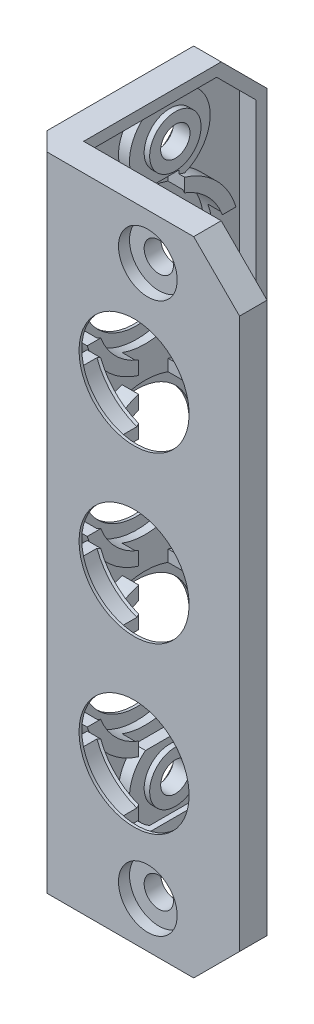
from build123d import *

# Parameters (mm, degrees)
EXTRUDE_THIN1_DEPTH     = 88.9
CHAMFER4_SIZE           = 2.54
CHAMFER1_SIZE           = 6.35
SKETCH2_R               = 9.2583
CUT_EXTRUDE1_DEPTH      = 3.429
SKETCH9_R               = 9.2583
SKETCH9_R_2             = 9.0043
EXTRUDE_THIN2_DEPTH     = 0.254
SKETCH4_R               = 7.62
CUT_EXTRUDE3_DEPTH      = 96.882897328
SKETCH3_R               = 9.2583
CUT_EXTRUDE2_DEPTH      = 3.429
SKETCH10_R              = 9.2583
SKETCH10_R_2            = 9.0043
EXTRUDE_THIN3_DEPTH     = 0.254
SKETCH5_R               = 7.62
CUT_EXTRUDE4_DEPTH      = 96.882897328
LPATTERN1_COUNT         = 3
LPATTERN1_PITCH         = 22.86
HOLE1_D                 = 4.064
HOLE1_CBORE_D           = 8.128
HOLE1_CBORE_DEPTH       = 1.524
HOLE2_D                 = 4.064
HOLE2_DEPTH             = 29.21
HOLE2_CBORE_D           = 8.128
HOLE2_CBORE_DEPTH       = 1.524
SHELL1_OUTLINE_R        = 10.7823
SHELL1_DEPTH            = 2.286
SHELL1_START            = -0.0126999
SHELL1_2_OUTLINE_R      = 3.556
SHELL1_2_DEPTH          = 0.7746999
SHELL1_START_2          = -2.286
SHELL1_3_OUTLINE_R      = 10.7823
SHELL1_3_DEPTH          = 2.286
SHELL1_START_3          = -0.762
SHELL1_4_OUTLINE_R      = 3.556
SHELL1_4_DEPTH          = 0.762
SHELL1_START_4          = 1.524
SHELL1_5_DEPTH          = 85.852
SHELL1_START_5          = 1
SHELL1_6_DEPTH          = 87
CHAMFER3_SIZE           = 0.254
CUT_EXTRUDE_THIN1_REACH = 97.883
SKETCH11_W              = 6.35
SKETCH11_H              = 67.2846
SKETCH11_W_2            = 21.5646
SKETCH11_H_2            = 6.35
CUT_EXTRUDE_THIN2_START = -2.286
SKETCH13_W              = 6.35
SKETCH13_H              = 67.2846
SKETCH13_W_2            = 21.5646
SKETCH13_H_2            = 6.35
CUT_EXTRUDE_THIN2_DEPTH = 2.286


with BuildPart() as part:
    # Sketch1 → Extrude-Thin1 (new body)
    with BuildSketch(Plane(origin=(0, 0, 0), x_dir=(1, 0, 0), z_dir=(0, 1, 0))):
        Polygon((0, 25.4), (0, 0), (25.4, 0), (25.4, -3.81), (-3.81, -3.81), (-3.81, 25.4), align=None)
    extrude(amount=EXTRUDE_THIN1_DEPTH)

    # Chamfer4
    chamfer4_edges = [part.edges().sort_by_distance(p)[0] for p in [
        (-3.81, 44.45, 3.81),
    ]]
    chamfer(chamfer4_edges, length=CHAMFER4_SIZE)

    # Chamfer1
    chamfer1_edges = [part.edges().sort_by_distance(p)[0] for p in [
        (-1.905, 88.9, -25.4),
        (-1.905, 0, -25.4),
        (25.4, 0, 1.905),
        (25.4, 88.9, 1.905),
    ]]
    chamfer(chamfer1_edges, length=CHAMFER1_SIZE)

    # Sketch2 → Cut-Extrude1 (cut)
    with BuildSketch(Plane(origin=(0, 0, 0), x_dir=(-1, 0, 0), z_dir=(0, 0, -1))):
        with Locations((-10.795, 67.31)):
            Circle(SKETCH2_R)
    cut_extrude1 = extrude(amount=-CUT_EXTRUDE1_DEPTH, mode=Mode.SUBTRACT)

    # Sketch9 → Extrude-Thin2 (add)
    with BuildSketch(Plane(origin=(0, 0, 0), x_dir=(-1, 0, 0), z_dir=(0, 0, -1))):
        with Locations((-10.795, 67.31)):
            Circle(SKETCH9_R)
        with Locations((-10.795, 67.31)):
            Circle(SKETCH9_R_2, mode=Mode.SUBTRACT)
    extrude_thin2 = extrude(amount=-EXTRUDE_THIN2_DEPTH)

    # Sketch4 → Cut-Extrude3 (cut, through all)
    with BuildSketch(Plane(origin=(0, 0, 0), x_dir=(-1, 0, 0), z_dir=(0, 0, -1))):
        with Locations((-10.795, 67.31)):
            Circle(SKETCH4_R)
    cut_extrude3 = extrude(amount=-CUT_EXTRUDE3_DEPTH, mode=Mode.SUBTRACT)

    # Sketch3 → Cut-Extrude2 (cut)
    with BuildSketch(Plane(origin=(0, 0, 0), x_dir=(0, 0, -1), z_dir=(1, 0, 0))):
        with Locations((10.795, 67.31)):
            Circle(SKETCH3_R)
    cut_extrude2 = extrude(amount=-CUT_EXTRUDE2_DEPTH, mode=Mode.SUBTRACT)

    # Sketch10 → Extrude-Thin3 (add)
    with BuildSketch(Plane(origin=(0, 0, 0), x_dir=(0, 0, -1), z_dir=(1, 0, 0))):
        with Locations((10.795, 67.31)):
            Circle(SKETCH10_R)
        with Locations((10.795, 67.31)):
            Circle(SKETCH10_R_2, mode=Mode.SUBTRACT)
    extrude_thin3 = extrude(amount=-EXTRUDE_THIN3_DEPTH)

    # Sketch5 → Cut-Extrude4 (cut, through all)
    with BuildSketch(Plane(origin=(0, 0, 0), x_dir=(0, 0, -1), z_dir=(1, 0, 0))):
        with Locations((10.795, 67.31)):
            Circle(SKETCH5_R)
    cut_extrude4 = extrude(amount=-CUT_EXTRUDE4_DEPTH, mode=Mode.SUBTRACT)

    # LPattern1: Cut-Extrude1, Extrude-Thin2, Cut-Extrude3, Cut-Extrude2, Extrude-Thin3, Cut-Extrude4 ×3
    with Locations(*[(0, -i * LPATTERN1_PITCH, 0) for i in range(1, LPATTERN1_COUNT)]):
        add(cut_extrude1, mode=Mode.SUBTRACT)
        add(extrude_thin2)
        add(cut_extrude3, mode=Mode.SUBTRACT)
        add(cut_extrude2, mode=Mode.SUBTRACT)
        add(extrude_thin3)
        add(cut_extrude4, mode=Mode.SUBTRACT)

    # Hole1 (through all)
    with Locations(Plane.XY.offset(3.81)):
        with Locations((12.7, 82.55), (12.7, 6.35)):
            CounterBoreHole(HOLE1_D / 2, HOLE1_CBORE_D / 2, HOLE1_CBORE_DEPTH)

    # Hole2
    with Locations(Plane.ZY.offset(3.81)):
        with Locations((-12.7, 82.55), (-12.7, 6.35)):
            CounterBoreHole(HOLE2_D / 2, HOLE2_CBORE_D / 2, HOLE2_CBORE_DEPTH, depth=HOLE2_DEPTH)

    # Shell1: read off the stored shape, not the designer's step
    # Shell1 outline → Shell1 (cut)
    with BuildSketch(Plane.XY):
        with BuildLine():
            ThreePointArc((15.516996273, 87.376), (18.271143767, 82.116293733), (14.736188344, 77.346185915))
            ThreePointArc((14.736188344, 77.346185915), (9.457620281, 56.61096225), (9.445524753, 78.007518864))
            ThreePointArc((9.445524753, 78.007518864), (7.11808265, 82.810658205), (9.883003727, 87.376))
            Line((9.883003727, 87.376), (0, 87.376))
            Line((0, 87.376), (0, 1.524))
            Line((0, 1.524), (9.883003727, 1.524))
            ThreePointArc((9.883003727, 1.524), (7.11808265, 6.089341795), (9.445524753, 10.892481136))
            ThreePointArc((9.445524753, 10.892481136), (9.457620281, 32.28903775), (14.736188344, 11.553814085))
            ThreePointArc((14.736188344, 11.553814085), (18.271143767, 6.783706267), (15.516996273, 1.524))
            Line((15.516996273, 1.524), (18.418738531, 1.524))
            Line((18.418738531, 1.524), (23.876, 6.981261469))
            Line((23.876, 6.981261469), (23.876, 81.918738531))
            Line((23.876, 81.918738531), (18.418738531, 87.376))
            Line((18.418738531, 87.376), (15.516996273, 87.376))
        make_face()
        with Locations((10.795, 44.45)):
            Circle(SHELL1_OUTLINE_R, mode=Mode.SUBTRACT)
    extrude(amount=SHELL1_DEPTH, mode=Mode.SUBTRACT)

    # Shell1 2 outline → Shell1 2 (cut)
    # profile 1 of 3: a face of its own
    with BuildSketch(Plane.XY.offset(SHELL1_START)):
        with BuildLine():
            ThreePointArc((9.445524753, 78.007518864), (12.132379719, 78.00903775), (14.736188344, 77.346185915))
            ThreePointArc((14.736188344, 77.346185915), (18.271143767, 82.116293733), (15.516996273, 87.376))
            Line((15.516996273, 87.376), (9.883003727, 87.376))
            ThreePointArc((9.883003727, 87.376), (7.11808265, 82.810658205), (9.445524753, 78.007518864))
        make_face()
        with Locations((12.7, 82.55)):
            Circle(SHELL1_2_OUTLINE_R, mode=Mode.SUBTRACT)
    # profile 2 of 3: a face of its own
    with BuildSketch(Plane.XY.offset(SHELL1_START)):
        Polygon((0, 1.524), (0, 87.376), (-0.762, 87.376), (-2.286, 87.376), (-2.286, 1.524), (-0.762, 1.524), align=None)
    # profile 3 of 3: a face of its own
    with BuildSketch(Plane.XY.offset(SHELL1_START)):
        with BuildLine():
            ThreePointArc((9.445524753, 10.892481136), (7.11808265, 6.089341795), (9.883003727, 1.524))
            Line((9.883003727, 1.524), (15.516996273, 1.524))
            ThreePointArc((15.516996273, 1.524), (18.271143767, 6.783706267), (14.736188344, 11.553814085))
            ThreePointArc((14.736188344, 11.553814085), (12.132379719, 10.89096225), (9.445524753, 10.892481136))
        make_face()
        with Locations((12.7, 6.35)):
            Circle(SHELL1_2_OUTLINE_R, mode=Mode.SUBTRACT)
    extrude(amount=SHELL1_2_DEPTH, mode=Mode.SUBTRACT)

    # Shell1 3 outline → Shell1 3 (cut)
    # profile 1 of 3: a face of its own
    with BuildSketch(Plane.YZ.offset(SHELL1_START_2)):
        with BuildLine():
            ThreePointArc((1.524, -9.883003727), (6.089341795, -7.11808265), (10.892481136, -9.445524753))
            ThreePointArc((10.892481136, -9.445524753), (14.458816847, -2.707712437), (21.59, -0.0127))
            Line((21.59, -0.0127), (1.524, -0.0126999))
            Line((1.524, -0.0126999), (1.524, -9.883003727))
        make_face()
    # profile 2 of 3: a face of its own
    with BuildSketch(Plane.YZ.offset(SHELL1_START_2)):
        with BuildLine():
            ThreePointArc((21.59, -0.0127), (30.499350941, -16.868010712), (11.553814085, -14.736188344))
            ThreePointArc((11.553814085, -14.736188344), (6.783706267, -18.271143767), (1.524, -15.516996273))
            Line((1.524, -15.516996273), (1.524, -18.418738531))
            Line((1.524, -18.418738531), (6.981261469, -23.876))
            Line((6.981261469, -23.876), (81.918738531, -23.876))
            Line((81.918738531, -23.876), (87.376, -18.418738531))
            Line((87.376, -18.418738531), (87.376, -15.516996273))
            ThreePointArc((87.376, -15.516996273), (82.116293733, -18.271143767), (77.346185915, -14.736188344))
            ThreePointArc((77.346185915, -14.736188344), (58.400649059, -16.868010712), (67.31, -0.0127))
            Line((67.31, -0.0127), (44.45, -0.0126999))
            Line((44.45, -0.0126999), (21.59, -0.0127))
        make_face()
        with Locations((44.45, -10.795)):
            Circle(SHELL1_3_OUTLINE_R, mode=Mode.SUBTRACT)
    # profile 3 of 3: a face of its own
    with BuildSketch(Plane.YZ.offset(SHELL1_START_2)):
        with BuildLine():
            Line((87.376, -0.0126999), (67.31, -0.0127))
            ThreePointArc((67.31, -0.0127), (74.441183153, -2.707712437), (78.007518864, -9.445524753))
            ThreePointArc((78.007518864, -9.445524753), (82.810658205, -7.11808265), (87.376, -9.883003727))
            Line((87.376, -9.883003727), (87.376, -0.0126999))
        make_face()
    extrude(amount=SHELL1_3_DEPTH, mode=Mode.SUBTRACT)

    # Shell1 4 outline → Shell1 4 (cut)
    # profile 1 of 2: a face of its own
    with BuildSketch(Plane.YZ.offset(SHELL1_START_3)):
        with BuildLine():
            ThreePointArc((11.553814085, -14.736188344), (10.89096225, -12.132379719), (10.892481136, -9.445524753))
            ThreePointArc((10.892481136, -9.445524753), (6.089341795, -7.11808265), (1.524, -9.883003727))
            Line((1.524, -9.883003727), (1.524, -15.516996273))
            ThreePointArc((1.524, -15.516996273), (6.783706267, -18.271143767), (11.553814085, -14.736188344))
        make_face()
        with Locations((6.35, -12.7)):
            Circle(SHELL1_4_OUTLINE_R, mode=Mode.SUBTRACT)
    # profile 2 of 2: a face of its own
    with BuildSketch(Plane.YZ.offset(SHELL1_START_3)):
        with BuildLine():
            ThreePointArc((87.376, -9.883003727), (82.810658205, -7.11808265), (78.007518864, -9.445524753))
            ThreePointArc((78.007518864, -9.445524753), (78.00903775, -12.132379719), (77.346185915, -14.736188344))
            ThreePointArc((77.346185915, -14.736188344), (82.116293733, -18.271143767), (87.376, -15.516996273))
            Line((87.376, -15.516996273), (87.376, -9.883003727))
        make_face()
        with Locations((82.55, -12.7)):
            Circle(SHELL1_4_OUTLINE_R, mode=Mode.SUBTRACT)
    extrude(amount=SHELL1_4_DEPTH, mode=Mode.SUBTRACT)

    # Shell1 5 outline → Shell1 5 (cut)
    with BuildSketch(Plane(origin=(0, 0, 0), x_dir=(1, 0, 0), z_dir=(0, 1, 0)).offset(SHELL1_START_4)):
        Polygon((-2.162738531, -0.762), (-0.638738531, -2.286), (0, -2.286), (0, -0.762), align=None)
    extrude(amount=SHELL1_5_DEPTH, mode=Mode.SUBTRACT)

    # Shell1 6 outline → Shell1 6 (add)
    with BuildSketch(Plane(origin=(0, 0, 0), x_dir=(1, 0, 0), z_dir=(0, 1, 0)).offset(SHELL1_START_5)):
        Polygon((-2.286, -0.762), (-2.162738531, -0.762), (-2.286, -0.638738531), align=None)
    extrude(amount=SHELL1_6_DEPTH)

    # Chamfer3
    chamfer3_edges = [part.edges().sort_by_distance(p)[0] for p in [
        (19.7993, 21.59, 0.254),
        (-0.254, 44.45, -1.7907),
        (-0.254, 21.59, -1.7907),
        (19.7993, 67.31, 0.254),
        (-0.254, 67.31, -1.7907),
        (19.7993, 44.45, 0.254),
    ]]
    chamfer(chamfer3_edges, length=CHAMFER3_SIZE - 0.0001)  # a hair under: the kernel refuses the full size

    # Cut-Extrude-Thin1: up to this face of the body (flat: up to its plane)
    cut_extrude_thin1_end = Plane(part.part.faces().sort_by_distance((19.161285243, 82.046997381, 2.286))[0])
    # Sketch11 → Cut-Extrude-Thin1 (cut, up to the picked face)
    with BuildSketch(Plane(origin=(0, 0, 0), x_dir=(-1, 0, 0), z_dir=(0, 0, -1)), mode=Mode.PRIVATE) as cut_extrude_thin1_sk1:
        with Locations((-10.795, 44.45)):
            Rectangle(SKETCH11_W, SKETCH11_H)
    cut_extrude_thin1_tool1 = split(extrude(cut_extrude_thin1_sk1.sketch, amount=-CUT_EXTRUDE_THIN1_REACH, mode=Mode.PRIVATE), bisect_by=cut_extrude_thin1_end, keep=Keep.BOTH, mode=Mode.PRIVATE)
    # Sketch11 → Cut-Extrude-Thin1 (cut, up to the picked face)
    with BuildSketch(Plane(origin=(0, 0, 0), x_dir=(-1, 0, 0), z_dir=(0, 0, -1)), mode=Mode.PRIVATE) as cut_extrude_thin1_sk2:
        with Locations((-10.795, 21.59)):
            Rectangle(SKETCH11_W_2, SKETCH11_H_2)
    cut_extrude_thin1_tool2 = split(extrude(cut_extrude_thin1_sk2.sketch, amount=-CUT_EXTRUDE_THIN1_REACH, mode=Mode.PRIVATE), bisect_by=cut_extrude_thin1_end, keep=Keep.BOTH, mode=Mode.PRIVATE)
    # Sketch11 → Cut-Extrude-Thin1 (cut, up to the picked face)
    with BuildSketch(Plane(origin=(0, 0, 0), x_dir=(-1, 0, 0), z_dir=(0, 0, -1)), mode=Mode.PRIVATE) as cut_extrude_thin1_sk3:
        with Locations((-10.795, 44.45)):
            Rectangle(SKETCH11_W_2, SKETCH11_H_2)
    cut_extrude_thin1_tool3 = split(extrude(cut_extrude_thin1_sk3.sketch, amount=-CUT_EXTRUDE_THIN1_REACH, mode=Mode.PRIVATE), bisect_by=cut_extrude_thin1_end, keep=Keep.BOTH, mode=Mode.PRIVATE)
    # Sketch11 → Cut-Extrude-Thin1 (cut, up to the picked face)
    with BuildSketch(Plane(origin=(0, 0, 0), x_dir=(-1, 0, 0), z_dir=(0, 0, -1)), mode=Mode.PRIVATE) as cut_extrude_thin1_sk4:
        with Locations((-10.795, 67.31)):
            Rectangle(SKETCH11_W_2, SKETCH11_H_2)
    cut_extrude_thin1_tool4 = split(extrude(cut_extrude_thin1_sk4.sketch, amount=-CUT_EXTRUDE_THIN1_REACH, mode=Mode.PRIVATE), bisect_by=cut_extrude_thin1_end, keep=Keep.BOTH, mode=Mode.PRIVATE)
    add(cut_extrude_thin1_tool1.solids().sort_by(Axis((10.795, 44.45, 0), (0, 0, 1)))[0], mode=Mode.SUBTRACT)
    add(cut_extrude_thin1_tool2.solids().sort_by(Axis((10.795, 21.59, 0), (0, 0, 1)))[0], mode=Mode.SUBTRACT)
    add(cut_extrude_thin1_tool3.solids().sort_by(Axis((10.795, 44.45, 0), (0, 0, 1)))[0], mode=Mode.SUBTRACT)
    add(cut_extrude_thin1_tool4.solids().sort_by(Axis((10.795, 67.31, 0), (0, 0, 1)))[0], mode=Mode.SUBTRACT)

    # Sketch13 → Cut-Extrude-Thin2 (cut)
    with BuildSketch(Plane(origin=(0, 0, 0), x_dir=(0, 0, -1), z_dir=(1, 0, 0)).offset(CUT_EXTRUDE_THIN2_START)):
        with Locations((10.795, 44.45)):
            Rectangle(SKETCH13_W, SKETCH13_H)
        with Locations((10.795, 21.59)):
            Rectangle(SKETCH13_W_2, SKETCH13_H_2)
        with Locations((10.795, 44.45)):
            Rectangle(SKETCH13_W_2, SKETCH13_H_2)
        with Locations((10.795, 67.31)):
            Rectangle(SKETCH13_W_2, SKETCH13_H_2)
    extrude(amount=CUT_EXTRUDE_THIN2_DEPTH, mode=Mode.SUBTRACT)


solid = part.part
